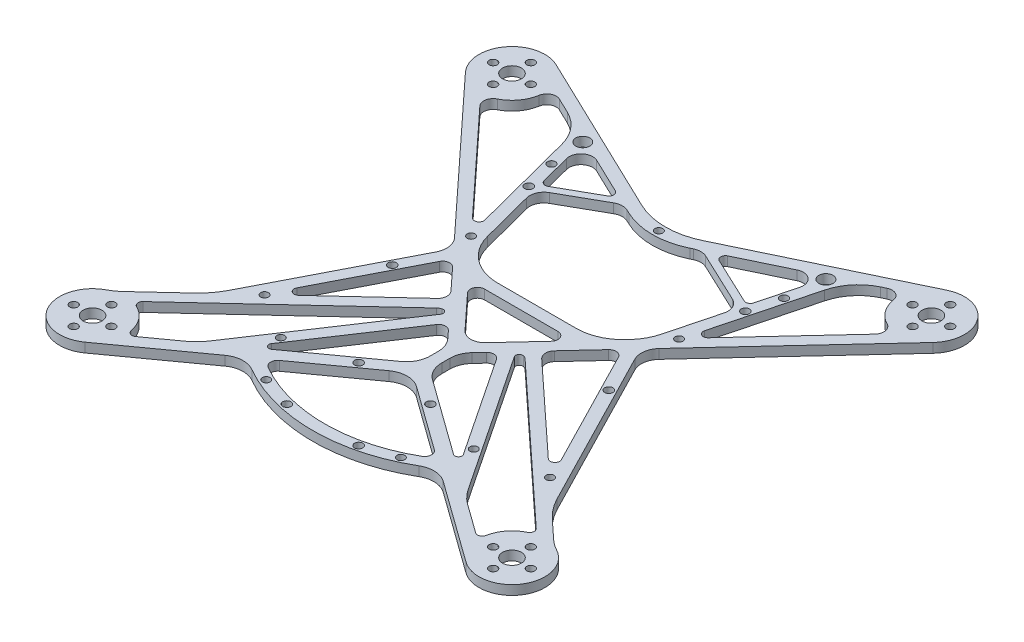
from build123d import *

# Parameters (mm, degrees)
SKETCH_1_R           = 1.7
SKETCH_1_R_2         = 4
EXTRUDE_1_DEPTH      = 4
CUT_EXTRUDE_3_DEPTH  = 10
SKETCH_8_W           = 63.440022532
SKETCH_8_H           = 42.439500262
CUT_EXTRUDE_4_DEPTH  = 10
SKETCH_9_R           = 1.75
CUT_EXTRUDE_5_DEPTH  = 10
SKETCH_10_R          = 1.75
CUT_EXTRUDE_6_DEPTH  = 10
CUT_EXTRUDE_7_DEPTH  = 10
FILLET_1_R           = 30
FILLET_2_R           = 4
FILLET_3_R           = 2
FILLET_4_R           = 20
FILLET_5_R           = 20
FILLET_6_R           = 20
FILLET_7_R           = 2
FILLET_8_R           = 3
FILLET_9_R           = 6
FILLET_10_R          = 2
FILLET_11_R          = 4
FILLET_12_R          = 8
FILLET_13_R          = 30
FILLET_14_R          = 3
FILLET_15_R          = 10
FILLET_16_R          = 4
FILLET_17_R          = 10
FILLET_18_R          = 3
FILLET_19_R          = 5
CUT_EXTRUDE_8_REACH  = 147.854
SKETCH_12_R          = 3
EXTRUDE_3_DEPTH      = 4
FILLET_20_R          = 2
FILLET_21_R          = 6
EXTRUDE_START        = -4
EXTRUDE_4_DEPTH      = 4
FILLET_22_R          = 1.5
FILLET_23_R          = 1.5
FILLET_24_R          = 3
FILLET_25_R          = 20
CUT_EXTRUDE_9_REACH  = 147.854
SKETCH_15_R          = 1.65
SKETCH_16_R          = 1.65
CUT_EXTRUDE_10_DEPTH = 146.853849617
SKETCH_17_R          = 1.7
CUT_EXTRUDE_11_DEPTH = 146.853849617
SKETCH_18_R          = 1.65
CUT_EXTRUDE_12_DEPTH = 146.853849617
FILLET_26_R          = 20


with BuildPart() as part:
    # 草图1 → 凸台-拉伸1 (new body)
    with BuildSketch(Plane(origin=(0, 0, 0), x_dir=(1, 0, 0), z_dir=(0, 1, 0))):
        with BuildLine():
            ThreePointArc((-154.59545443, -89.09545443), (-135.410948597, -135.410948597), (-89.09545443, -154.59545443))
            Line((-89.09545443, -154.59545443), (89.09545443, -154.59545443))
            ThreePointArc((89.09545443, -154.59545443), (135.410948597, -135.410948597), (154.59545443, -89.09545443))
            Line((154.59545443, -89.09545443), (154.59545443, 89.09545443))
            ThreePointArc((154.59545443, 89.09545443), (135.410948597, 135.410948597), (89.09545443, 154.59545443))
            Line((89.09545443, 154.59545443), (-89.09545443, 154.59545443))
            ThreePointArc((-89.09545443, 154.59545443), (-135.410948597, 135.410948597), (-154.59545443, 89.09545443))
            Line((-154.59545443, 89.09545443), (-154.59545443, -89.09545443))
        make_face()
        with Locations(Location((-89.095454429, -97.09545443, 0), (0, 0, 270))):
            Circle(SKETCH_1_R, mode=Mode.SUBTRACT)
        with Locations(Location((-97.095454429, -89.09545443, 0), (0, 0, 270))):
            Circle(SKETCH_1_R, mode=Mode.SUBTRACT)
        with Locations(Location((-89.095454429, -89.09545443, 0), (0, 0, 270))):
            Circle(SKETCH_1_R_2, mode=Mode.SUBTRACT)
        with Locations(Location((89.09545443, -97.09545443, 0), (0, 0, 270))):
            Circle(SKETCH_1_R, mode=Mode.SUBTRACT)
        with Locations(Location((89.09545443, -89.09545443, 0), (0, 0, 270))):
            Circle(SKETCH_1_R_2, mode=Mode.SUBTRACT)
        with Locations(Location((97.09545443, -89.09545443, 0), (0, 0, 270))):
            Circle(SKETCH_1_R, mode=Mode.SUBTRACT)
        with Locations(Location((-97.09545443, 89.095454429, 0), (0, 0, 270))):
            Circle(SKETCH_1_R, mode=Mode.SUBTRACT)
        with Locations(Location((-89.09545443, 81.095454429, 0), (0, 0, 270))):
            Circle(SKETCH_1_R, mode=Mode.SUBTRACT)
        with Locations(Location((-89.09545443, 89.095454429, 0), (0, 0, 270))):
            Circle(SKETCH_1_R_2, mode=Mode.SUBTRACT)
        with Locations(Location((-81.09545443, 89.095454429, 0), (0, 0, 270))):
            Circle(SKETCH_1_R, mode=Mode.SUBTRACT)
        with Locations(Location((-89.09545443, 97.095454429, 0), (0, 0, 270))):
            Circle(SKETCH_1_R, mode=Mode.SUBTRACT)
        with Locations(Location((89.09545443, 81.09545443, 0), (0, 0, 270))):
            Circle(SKETCH_1_R, mode=Mode.SUBTRACT)
        with Locations(Location((81.09545443, 89.09545443, 0), (0, 0, 270))):
            Circle(SKETCH_1_R, mode=Mode.SUBTRACT)
        with Locations(Location((89.09545443, 89.09545443, 0), (0, 0, 270))):
            Circle(SKETCH_1_R_2, mode=Mode.SUBTRACT)
        with Locations(Location((89.09545443, 97.09545443, 0), (0, 0, 270))):
            Circle(SKETCH_1_R, mode=Mode.SUBTRACT)
        with Locations(Location((97.09545443, 89.09545443, 0), (0, 0, 270))):
            Circle(SKETCH_1_R, mode=Mode.SUBTRACT)
        with Locations(Location((81.09545443, -89.09545443, 0), (0, 0, 270))):
            Circle(SKETCH_1_R, mode=Mode.SUBTRACT)
        with Locations(Location((89.09545443, -81.09545443, 0), (0, 0, 270))):
            Circle(SKETCH_1_R, mode=Mode.SUBTRACT)
        with Locations(Location((-89.095454429, -81.09545443, 0), (0, 0, 270))):
            Circle(SKETCH_1_R, mode=Mode.SUBTRACT)
        with Locations(Location((-81.095454429, -89.09545443, 0), (0, 0, 270))):
            Circle(SKETCH_1_R, mode=Mode.SUBTRACT)
    extrude(amount=EXTRUDE_1_DEPTH)

    # 草图6 → 切除-拉伸3 (cut)
    with BuildSketch(Plane.XZ):
        with BuildLine():
            ThreePointArc((-89.09545443, 154.59545443), (-135.410948597, 135.410948597), (-154.59545443, 89.09545443))
            Line((-154.59545443, 89.09545443), (-154.59545443, -89.09545443))
            ThreePointArc((-154.59545443, -89.09545443), (-135.410948597, -135.410948597), (-89.09545443, -154.59545443))
            Line((-89.09545443, -154.59545443), (89.09545443, -154.59545443))
            ThreePointArc((89.09545443, -154.59545443), (135.410948597, -135.410948597), (154.59545443, -89.09545443))
            Line((154.59545443, -89.09545443), (154.59545443, 89.09545443))
            ThreePointArc((154.59545443, 89.09545443), (135.410948597, 135.410948597), (89.09545443, 154.59545443))
            Line((89.09545443, 154.59545443), (-89.09545443, 154.59545443))
        make_face()
        with BuildLine():
            Line((-89.09545443, 103.09545443), (89.09545443, 103.09545443))
            ThreePointArc((89.09545443, 103.09545443), (98.994949366, 98.994949366), (103.09545443, 89.09545443))
            Line((103.09545443, 89.09545443), (103.09545443, -89.09545443))
            ThreePointArc((103.09545443, -89.09545443), (98.994949366, -98.994949366), (89.09545443, -103.09545443))
            Line((89.09545443, -103.09545443), (-89.09545443, -103.09545443))
            ThreePointArc((-89.09545443, -103.09545443), (-98.994949366, -98.994949366), (-103.09545443, -89.09545443))
            Line((-103.09545443, -89.09545443), (-103.09545443, 89.09545443))
            ThreePointArc((-103.09545443, 89.09545443), (-98.994949366, 98.994949366), (-89.09545443, 103.09545443))
        make_face(mode=Mode.SUBTRACT)
    extrude(amount=-CUT_EXTRUDE_3_DEPTH, mode=Mode.SUBTRACT)

    # 草图8 → 切除-拉伸4 (cut)
    with BuildSketch(Plane(origin=(0, 4, 0), x_dir=(1, 0, 0), z_dir=(0, 1, 0))):
        with Locations((0, 35.15)):
            Rectangle(SKETCH_8_W, SKETCH_8_H)
    extrude(amount=-CUT_EXTRUDE_4_DEPTH, mode=Mode.SUBTRACT)

    # 草图9 → 切除-拉伸5 (cut)
    with BuildSketch(Plane(origin=(0, 4, 0), x_dir=(1, 0, 0), z_dir=(0, 1, 0))):
        with Locations(Location((-15.25, -49.9, 0), (0, 0, 270))):
            Circle(SKETCH_9_R)
        with Locations(Location((15.25, -49.9, 0), (0, 0, 270))):
            Circle(SKETCH_9_R)
        with Locations(Location((15.25, -80.4, 0), (0, 0, 270))):
            Circle(SKETCH_9_R)
        with Locations(Location((-15.25, -80.4, 0), (0, 0, 270))):
            Circle(SKETCH_9_R)
    extrude(amount=-CUT_EXTRUDE_5_DEPTH, mode=Mode.SUBTRACT)

    # 草图10 → 切除-拉伸6 (cut)
    with BuildSketch(Plane.XZ):
        with Locations(Location((-44, -51.14, 0), (0, 0, 270))):
            Circle(SKETCH_10_R)
        with Locations(Location((48, -51.14, 0), (0, 0, 270))):
            Circle(SKETCH_10_R)
        with Locations(Location((48, 6.86, 0), (0, 0, 270))):
            Circle(SKETCH_10_R)
        with Locations(Location((-44, 6.86, 0), (0, 0, 270))):
            Circle(SKETCH_10_R)
    extrude(amount=-CUT_EXTRUDE_6_DEPTH, mode=Mode.SUBTRACT)

    # 草图11 → 切除-拉伸7 (cut)
    with BuildSketch(Plane.XZ):
        with BuildLine():
            ThreePointArc((-103.09545443, -89.095454429), (-102.129483262, -83.985259483), (-99.364869802, -79.58025039))
            Line((-99.364869802, -79.58025039), (-36.990326612, -12.261663205))
            Line((-36.990326612, -12.261663205), (-71.809343653, 55.537938932))
            Line((-71.809343653, 55.537938932), (-93.793043515, 75.907101356))
            ThreePointArc((-93.793043515, 75.907101356), (-100.535870663, 81.02595157), (-103.095454429, 89.09545443))
            Line((-103.09545443, 89.09545443), (-103.09545443, -89.09545443))
        make_face()
        with BuildLine():
            Line((-38.908809431, -21.688859573), (-88.408707494, -75.112308194))
            ThreePointArc((-88.408707494, -75.112308194), (-77.826430979, -80.788282199), (-75.535008282, -92.57601477))
            Line((-75.535008282, -92.57601477), (-54.790085158, -82.632331786))
            Line((-54.790085158, -82.632331786), (-38.908809431, -21.688859573))
        make_face()
        Polygon((-61.085857277, 45.60201199), (-33.373944955, -8.358633356), (-19.273005775, 6.86), align=None)
        with BuildLine():
            ThreePointArc((-83.044085578, -101.720070662), (-85.9926031, -102.747278983), (-89.09545443, -103.095454429))
            Line((-89.09545443, -103.09545443), (89.09545443, -103.09545443))
            ThreePointArc((89.09545443, -103.09545443), (85.9926031, -102.747278983), (83.044085578, -101.720070662))
            Line((83.044085578, -101.720070662), (0, -61.914473131))
            Line((0, -61.914473131), (-83.044085578, -101.720070662))
        make_face()
        Polygon((-31.720011266, -56.369750131), (-31.720011266, -13.930249869), (-48.885579435, -79.802119655), (0, -56.369750131), align=None)
        Polygon((-27.087223666, -8.930249869), (-31.720011266, -13.930249869), (31.720011266, -13.930249869), (27.087223666, -8.930249869), align=None)
        with BuildLine():
            Line((89.09545443, 103.09545443), (-89.09545443, 103.09545443))
            ThreePointArc((-89.09545443, 103.09545443), (-84.797456657, 102.419388351), (-80.914563242, 100.456485165))
            Line((-80.914563242, 100.456485165), (-40.839059354, 71.598774608))
            ThreePointArc((-40.839059354, 71.598774608), (0, 84.632077896), (40.839059354, 71.598774608))
            Line((40.839059354, 71.598774608), (80.914563242, 100.456485165))
            ThreePointArc((80.914563242, 100.456485165), (84.797456657, 102.419388351), (89.09545443, 103.09545443))
        make_face()
        with BuildLine():
            ThreePointArc((-75.109915966, 89.731625711), (-77.944087366, 80.630998592), (-85.947369229, 75.453989715))
            Line((-85.947369229, 75.453989715), (-15.874718618, 10.527648347))
            Line((-15.874718618, 10.527648347), (-2.5, 24.962498133))
            Line((-2.5, 24.962498133), (-2.5, 37.446420654))
            Line((-2.5, 37.446420654), (-75.109915966, 89.731625711))
        make_face()
        Polygon((37.285194938, -19.936551208), (31.720011266, -13.930249869), (31.720011266, -56.369750131), (0, -56.369750131), (53.456532477, -81.993118759), align=None)
        with BuildLine():
            ThreePointArc((99.364869802, -79.58025039), (102.129483262, -83.985259483), (103.09545443, -89.09545443))
            Line((103.09545443, -89.09545443), (103.09545443, 89.09545443))
            ThreePointArc((103.09545443, 89.09545443), (100.535870663, 81.02595157), (93.793043515, 75.907101356))
            Line((93.793043515, 75.907101356), (79.440614039, 62.608749895))
            Line((79.440614039, 62.608749895), (39.563891334, -15.039218475))
            Line((39.563891334, -15.039218475), (99.364869802, -79.58025039))
        make_face()
        Polygon((0, 20.304010371), (-22.454436066, -3.930249869), (22.454436066, -3.930249869), align=None)
        with BuildLine():
            Line((59.361038201, -84.823330891), (75.535008282, -92.57601477))
            ThreePointArc((75.535008282, -92.57601477), (77.826430979, -80.788282199), (88.408707494, -75.112308194))
            Line((88.408707494, -75.112308194), (44.473993104, -27.695160912))
            Line((44.473993104, -27.695160912), (59.361038201, -84.823330891))
        make_face()
        with BuildLine():
            ThreePointArc((85.947369229, 75.453989715), (77.944087366, 80.630998592), (75.109915966, 89.731625711))
            Line((75.109915966, 89.731625711), (2.5, 37.446420654))
            Line((2.5, 37.446420654), (2.5, 24.962498133))
            Line((2.5, 24.962498133), (15.874718618, 10.527648347))
            Line((15.874718618, 10.527648347), (85.947369229, 75.453989715))
        make_face()
        with BuildLine():
            ThreePointArc((36.532542507, 68.497722728), (0, 79.632077896), (-36.532542507, 68.497722728))
            Line((-36.532542507, 68.497722728), (0, 42.191240331))
            Line((0, 42.191240331), (36.532542507, 68.497722728))
        make_face()
        Polygon((19.273005775, 6.86), (35.947509678, -11.136188627), (68.717127663, 52.672822953), align=None)
    extrude(amount=-CUT_EXTRUDE_7_DEPTH, mode=Mode.SUBTRACT)

    # 圆角1
    fillet_1_edges = [part.edges().sort_by_distance(p)[0] for p in [
        (0, 2, -56.369750131),
        (0, 2, -61.914473131),
    ]]
    fillet(fillet_1_edges, radius=FILLET_1_R)

    # 圆角2
    fillet_2_edges = [part.edges().sort_by_distance(p)[0] for p in [
        (-75.535008282, 2, -92.57601477),
        (-88.408707494, 2, -75.112308194),
        (75.535008282, 2, -92.57601477),
        (88.408707494, 2, -75.112308194),
    ]]
    fillet(fillet_2_edges, radius=FILLET_2_R)

    # 圆角3
    fillet_3_edges = [part.edges().sort_by_distance(p)[0] for p in [
        (-85.947369229, 2, 75.453989715),
        (-75.109915966, 2, 89.731625711),
        (85.947369229, 2, 75.453989715),
        (75.109915966, 2, 89.731625711),
    ]]
    fillet(fillet_3_edges, radius=FILLET_3_R)

    # 圆角4
    fillet_4_edges = [part.edges().sort_by_distance(p)[0] for p in [
        (-54.790085158, 2, -82.632331786),
        (59.361038201, 2, -84.823330891),
    ]]
    fillet(fillet_4_edges, radius=FILLET_4_R)

    # 圆角5
    # the kernel refuses this fillet: 20 mm, written as the material it adds along each edge
    with BuildSketch(Plane(origin=(27.087223666, 0, -8.930249869), x_dir=(-1, 0, 0), z_dir=(0, 1, 0))) as fillet_5_piece_1:
        with BuildLine():
            CenterArc((FILLET_5_R * 0.436713853534, -FILLET_5_R), FILLET_5_R, 90, 47.183120681)
            Line((-FILLET_5_R * 0.296815815934, -FILLET_5_R * 0.320342568635), (-FILLET_5_R * 0.311486409324, -FILLET_5_R * 0.306749420008))
            Line((-FILLET_5_R * 0.311486409324, -FILLET_5_R * 0.306749420008), (-FILLET_5_R * 0.00873427707068, FILLET_5_R * 0.02))
            Line((-FILLET_5_R * 0.00873427707068, FILLET_5_R * 0.02), (FILLET_5_R * 0.436713853534, FILLET_5_R * 0.02))
            Line((FILLET_5_R * 0.436713853534, FILLET_5_R * 0.02), (FILLET_5_R * 0.436713853534, 0))
        make_face()
    extrude(amount=4)
    with BuildSketch(Plane(origin=(-27.087223666, 0, -8.930249869), x_dir=(-0.6796574313648172, 0, -0.7335296694685082), z_dir=(0, 1, 0))) as fillet_5_piece_2:
        with BuildLine():
            CenterArc((8.828279209, -19.898546894), FILLET_5_R, 95.773498572, 41.409622109)
            Line((-5.84231418, -6.305398267), (-6.135726048, -6.033535294))
            Line((-6.135726048, -6.033535294), (-0.293411868, 0.271862973))
            Line((-0.293411868, 0.271862973), (0, 0.4))
            ThreePointArc((0, 0.4), (3.408178434, 0.4), (6.776118421, 0.397970938))
            Line((6.776118421, 0.397970938), (6.816356868, 0))
        make_face()
    extrude(amount=4)

    # 圆角6
    # the kernel refuses this fillet: 20 mm, written as the material it adds along each edge
    with BuildSketch(Plane(origin=(-31.720011266, 4, -13.930249869), x_dir=(0.9582614146771681, 0, 0.28589344368297887), z_dir=(0, -1, 0))) as fillet_6_piece_1:
        with BuildLine():
            CenterArc((11.771164577, -19.165228294), FILLET_6_R, 73.387738596, 75.39410998)
            Line((-5.332837526, -8.799269002), (-7.043237737, -7.762673073))
            Line((-7.043237737, -7.762673073), (-1.71040021, 1.036595929))
            Line((-1.71040021, 1.036595929), (-0.838820532, 1.815593599))
            ThreePointArc((-0.838820532, 1.815593599), (14.677861077, 2.925815135), (18.060820338, 1.916522829))
            Line((18.060820338, 1.916522829), (17.489033451, 0))
        make_face()
    extrude(amount=4)
    with BuildSketch(Plane(origin=(37.285194938, 0, -19.936551208), x_dir=(0.2521688376534138, 0, -0.9676832525762376), z_dir=(0, 1, 0))) as fillet_6_piece_2:
        with BuildLine():
            CenterArc((FILLET_6_R * 0.25128459123, FILLET_6_R), FILLET_6_R, 241.789010701, 28.210989299)
            Line((-FILLET_6_R * 0.221435198456, FILLET_6_R * 0.118787199118), (0, 0))
            Line((0, 0), (FILLET_6_R * 0.25128459123, 0))
        make_face()
    extrude(amount=4)

    # 圆角7
    fillet_7_edges = [part.edges().sort_by_distance(p)[0] for p in [
        (-38.908809431, 2, -21.688859573),
        (44.473993104, 2, -27.695160912),
    ]]
    fillet(fillet_7_edges, radius=FILLET_7_R)

    # 圆角8
    fillet_8_edges = [part.edges().sort_by_distance(p)[0] for p in [
        (-22.454436066, 2, -3.930249869),
        (22.454436066, 2, -3.930249869),
    ]]
    fillet(fillet_8_edges, radius=FILLET_8_R)

    # 圆角9
    fillet_9_edges = [part.edges().sort_by_distance(p)[0] for p in [
        (0, 2, 20.304010371),
    ]]
    fillet(fillet_9_edges, radius=FILLET_9_R)

    # 圆角10
    fillet_10_edges = [part.edges().sort_by_distance(p)[0] for p in [
        (-61.085857277, 2, 45.60201199),
        (68.717127663, 2, 52.672822953),
    ]]
    fillet(fillet_10_edges, radius=FILLET_10_R)

    # 圆角11
    fillet_11_edges = [part.edges().sort_by_distance(p)[0] for p in [
        (-19.273005775, 2, 6.86),
        (19.273005775, 2, 6.86),
    ]]
    fillet(fillet_11_edges, radius=FILLET_11_R)

    # 圆角12
    fillet_12_edges = [part.edges().sort_by_distance(p)[0] for p in [
        (-36.990326612, 2, -12.261663205),
        (39.563891334, 2, -15.039218475),
    ]]
    fillet(fillet_12_edges, radius=FILLET_12_R)

    # 圆角13
    fillet_13_edges = [part.edges().sort_by_distance(p)[0] for p in [
        (-71.809343653, 2, 55.537938932),
        (79.440614039, 2, 62.608749895),
    ]]
    fillet(fillet_13_edges, radius=FILLET_13_R)

    # 圆角14
    fillet_14_edges = [part.edges().sort_by_distance(p)[0] for p in [
        (-33.373944955, 2, -8.358633356),
        (35.947509678, 2, -11.136188627),
    ]]
    fillet(fillet_14_edges, radius=FILLET_14_R)

    # 圆角15
    fillet_15_edges = [part.edges().sort_by_distance(p)[0] for p in [
        (-2.5, 2, 37.446420654),
        (-2.5, 2, 24.962498133),
        (0, 2, 42.191240331),
        (2.5, 2, 24.962498133),
        (2.5, 2, 37.446420654),
    ]]
    fillet(fillet_15_edges, radius=FILLET_15_R)

    # 圆角16
    fillet_16_edges = [part.edges().sort_by_distance(p)[0] for p in [
        (-15.874718618, 2, 10.527648347),
        (15.874718618, 2, 10.527648347),
    ]]
    fillet(fillet_16_edges, radius=FILLET_16_R)

    # 圆角17
    fillet_17_edges = [part.edges().sort_by_distance(p)[0] for p in [
        (40.839059354, 2, 71.598774608),
        (-40.839059354, 2, 71.598774608),
    ]]
    fillet(fillet_17_edges, radius=FILLET_17_R)

    # 圆角18
    fillet_18_edges = [part.edges().sort_by_distance(p)[0] for p in [
        (-36.532542507, 2, 68.497722728),
        (36.532542507, 2, 68.497722728),
    ]]
    fillet(fillet_18_edges, radius=FILLET_18_R)

    # 圆角19
    fillet_19_edges = [part.edges().sort_by_distance(p)[0] for p in [
        (-48.885579435, 2, -79.802119655),
        (53.456532477, 2, -81.993118759),
    ]]
    fillet(fillet_19_edges, radius=FILLET_19_R)

    # 草图12 → 切除-拉伸8 (cut, up to next)
    with BuildSketch(Plane(origin=(0, 4, 0), x_dir=(1, 0, 0), z_dir=(0, 1, 0)), mode=Mode.PRIVATE) as cut_extrude_8_sk1:
        with Locations(Location((-48.813035876, 78.887998895, 0), (0, 0, 270))):
            Circle(SKETCH_12_R)
    cut_extrude_8_tool1 = extrude(cut_extrude_8_sk1.sketch, amount=-CUT_EXTRUDE_8_REACH, mode=Mode.PRIVATE) & part.part
    # 草图12 → 切除-拉伸8 (cut, up to next)
    with BuildSketch(Plane(origin=(0, 4, 0), x_dir=(1, 0, 0), z_dir=(0, 1, 0)), mode=Mode.PRIVATE) as cut_extrude_8_sk2:
        with Locations(Location((53.365030843, 80.008516924, 0), (0, 0, 270))):
            Circle(SKETCH_12_R)
    cut_extrude_8_tool2 = extrude(cut_extrude_8_sk2.sketch, amount=-CUT_EXTRUDE_8_REACH, mode=Mode.PRIVATE) & part.part
    add(cut_extrude_8_tool1.solids().sort_by_distance((-48.813036, 4, -78.887999))[0], mode=Mode.SUBTRACT)
    add(cut_extrude_8_tool2.solids().sort_by_distance((53.365031, 4, -80.008517))[0], mode=Mode.SUBTRACT)

    # 草图13 → 凸台-拉伸3 (add)
    with BuildSketch(Plane(origin=(0, 4, 0), x_dir=(1, 0, 0), z_dir=(0, 1, 0))):
        Polygon((-41.356997073, 50.911622578), (-17.162830501, 64.59642538), (-20.461199355, 66.177435541), (-42.139780483, 53.915508399), align=None)
        Polygon((46.084289328, 53.702564322), (20.057258291, 65.983814101), (16.569844589, 64.3121889), (45.314510272, 50.74858195), align=None)
    extrude(amount=-EXTRUDE_3_DEPTH)

    # 圆角20
    fillet_20_edges = [part.edges().sort_by_distance(p)[0] for p in [
        (-20.461199355, 2, -66.177435541),
        (-42.139780483, 2, -53.915508399),
        (20.057258291, 2, -65.983814101),
        (46.084289328, 2, -53.702564322),
    ]]
    fillet(fillet_20_edges, radius=FILLET_20_R)

    # 圆角21
    fillet_21_edges = [part.edges().sort_by_distance(p)[0] for p in [
        (-17.162830501, 2, -64.59642538),
        (-41.356997073, 2, -50.911622578),
        (16.569844589, 2, -64.3121889),
        (45.314510272, 2, -50.74858195),
    ]]
    fillet(fillet_21_edges, radius=FILLET_21_R)

    # 草图14 → 凸台-拉伸4 (add)
    with BuildSketch(Plane.XZ.offset(EXTRUDE_START)):
        with BuildLine():
            ThreePointArc((-14.286154053, 12.610327997), (-13.683174949, 12.985683312), (-13.156088893, 13.461767025))
            Line((-13.156088893, 13.461767025), (-10.648241238, 16.168396243))
            Line((-10.648241238, 16.168396243), (-45.363694428, 68.311861315))
            Line((-45.363694428, 68.311861315), (-56.902035511, 76.620430765))
            Line((-56.902035511, 76.620430765), (-14.286154053, 12.610327997))
        make_face()
        with BuildLine():
            Line((56.902035511, 76.620430765), (45.363694428, 68.311861315))
            Line((45.363694428, 68.311861315), (10.648241238, 16.168396243))
            Line((10.648241238, 16.168396243), (13.156088893, 13.461767025))
            ThreePointArc((13.156088893, 13.461767025), (13.683174949, 12.985683312), (14.286154053, 12.610327997))
            Line((14.286154053, 12.610327997), (56.902035511, 76.620430765))
        make_face()
    extrude(amount=EXTRUDE_4_DEPTH)

    # 圆角22
    fillet_22_edges = [part.edges().sort_by_distance(p)[0] for p in [
        (-14.286154053, 2, 12.610327997),
        (14.286154053, 2, 12.610327997),
    ]]
    fillet(fillet_22_edges, radius=FILLET_22_R)

    # 圆角23
    fillet_23_edges = [part.edges().sort_by_distance(p)[0] for p in [
        (-45.363694428, 2, 68.311861315),
        (45.363694428, 2, 68.311861315),
    ]]
    fillet(fillet_23_edges, radius=FILLET_23_R)

    # 圆角24
    fillet_24_edges = [part.edges().sort_by_distance(p)[0] for p in [
        (-10.648241238, 2, 16.168396243),
        (10.648241238, 2, 16.168396243),
    ]]
    fillet(fillet_24_edges, radius=FILLET_24_R)

    # 圆角25
    fillet_25_edges = [part.edges().sort_by_distance(p)[0] for p in [
        (-56.902035511, 2, 76.620430765),
        (56.902035511, 2, 76.620430765),
    ]]
    fillet(fillet_25_edges, radius=FILLET_25_R)

    # 草图15 → 切除-拉伸9 (cut, up to next)
    with BuildSketch(Plane.XZ, mode=Mode.PRIVATE) as cut_extrude_9_sk1:
        with Locations(Location((-40.989953403, 57.23124324, 0), (0, 0, 270))):
            Circle(SKETCH_15_R)
    cut_extrude_9_tool1 = extrude(cut_extrude_9_sk1.sketch, amount=-CUT_EXTRUDE_9_REACH, mode=Mode.PRIVATE) & part.part
    # 草图15 → 切除-拉伸9 (cut, up to next)
    with BuildSketch(Plane.XZ, mode=Mode.PRIVATE) as cut_extrude_9_sk2:
        with Locations(Location((40.989953403, 57.23124324, 0), (0, 0, 270))):
            Circle(SKETCH_15_R)
    cut_extrude_9_tool2 = extrude(cut_extrude_9_sk2.sketch, amount=-CUT_EXTRUDE_9_REACH, mode=Mode.PRIVATE) & part.part
    add(cut_extrude_9_tool1.solids().sort_by_distance((-40.989953, 0, 57.231243))[0], mode=Mode.SUBTRACT)
    add(cut_extrude_9_tool2.solids().sort_by_distance((40.989953, 0, 57.231243))[0], mode=Mode.SUBTRACT)

    # 草图16 → 切除-拉伸10 (cut, through all)
    with BuildSketch(Plane.XZ):
        with Locations(Location((0, -62.410449635, 0), (0, 0, 270))):
            Circle(SKETCH_16_R)
    extrude(amount=-CUT_EXTRUDE_10_DEPTH, mode=Mode.SUBTRACT)

    # 草图17 → 切除-拉伸11 (cut, through all)
    with BuildSketch(Plane(origin=(0, 4, 0), x_dir=(1, 0, 0), z_dir=(0, 1, 0))):
        with Locations(Location((-47.396642311, 64.174417375, 0), (0, 0, 270))):
            Circle(SKETCH_17_R)
        with Locations(Location((51.396642311, 64.174417375, 0), (0, 0, 270))):
            Circle(SKETCH_17_R)
    extrude(amount=-CUT_EXTRUDE_11_DEPTH, mode=Mode.SUBTRACT)

    # 草图18 → 切除-拉伸12 (cut, through all)
    with BuildSketch(Plane(origin=(0, 4, 0), x_dir=(1, 0, 0), z_dir=(0, 1, 0))):
        with Locations(Location((44.1, 26.89, 0), (0, 0, 270))):
            Circle(SKETCH_18_R)
        with Locations(Location((-37.929803622, 20.552893435, 0), (0, 0, 270))):
            Circle(SKETCH_18_R)
        with Locations(Location((-60.201437699, -44.933461153, 0), (0, 0, 270))):
            Circle(SKETCH_18_R)
        with Locations(Location((67.632870637, -51.487254798, 0), (0, 0, 270))):
            Circle(SKETCH_18_R)
        with Locations(Location((-28.610131123, -75.820370589, 0), (0, 0, 270))):
            Circle(SKETCH_18_R)
        with Locations(Location((28.610131123, -75.820370589, 0), (0, 0, 90))):
            Circle(SKETCH_18_R)
    extrude(amount=-CUT_EXTRUDE_12_DEPTH, mode=Mode.SUBTRACT)

    # 圆角26
    fillet_26_edges = [part.edges().sort_by_distance(p)[0] for p in [
        (-93.793043515, 2, 75.907101356),
        (93.793043515, 2, 75.907101356),
    ]]
    fillet(fillet_26_edges, radius=FILLET_26_R)


solid = part.part
